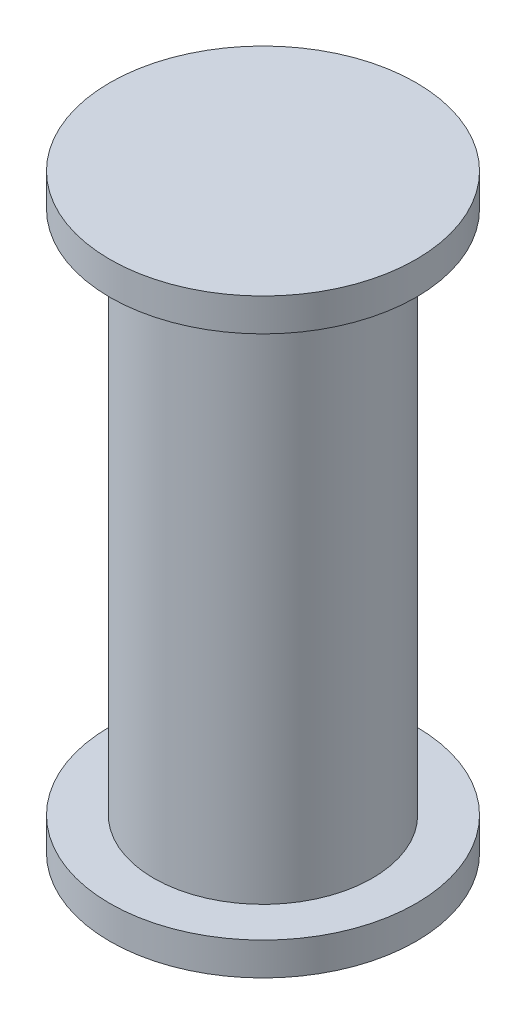
from build123d import *

# Parameters (mm, degrees)
SKETCH1_R           = 5
BOSS_EXTRUDE1_DEPTH = 12
SKETCH2_R           = 7
BOSS_EXTRUDE2_DEPTH = 1.5


with BuildPart() as part:
    # Sketch1 → Boss-Extrude1 (new, symmetric)
    with BuildSketch(Plane(origin=(0, 0, 0), x_dir=(1, 0, 0), z_dir=(0, 1, 0))):
        Circle(SKETCH1_R)
    extrude(amount=BOSS_EXTRUDE1_DEPTH, both=True)

    # Sketch2 → Boss-Extrude2 (add)
    with BuildSketch(Plane(origin=(0, 12, 0), x_dir=(1, 0, 0), z_dir=(0, 1, 0))):
        Circle(SKETCH2_R)
    boss_extrude2 = extrude(amount=BOSS_EXTRUDE2_DEPTH)

    # Mirror1: Boss-Extrude2 across plane
    add(boss_extrude2.mirror(Plane.ZX))


solid = part.part
